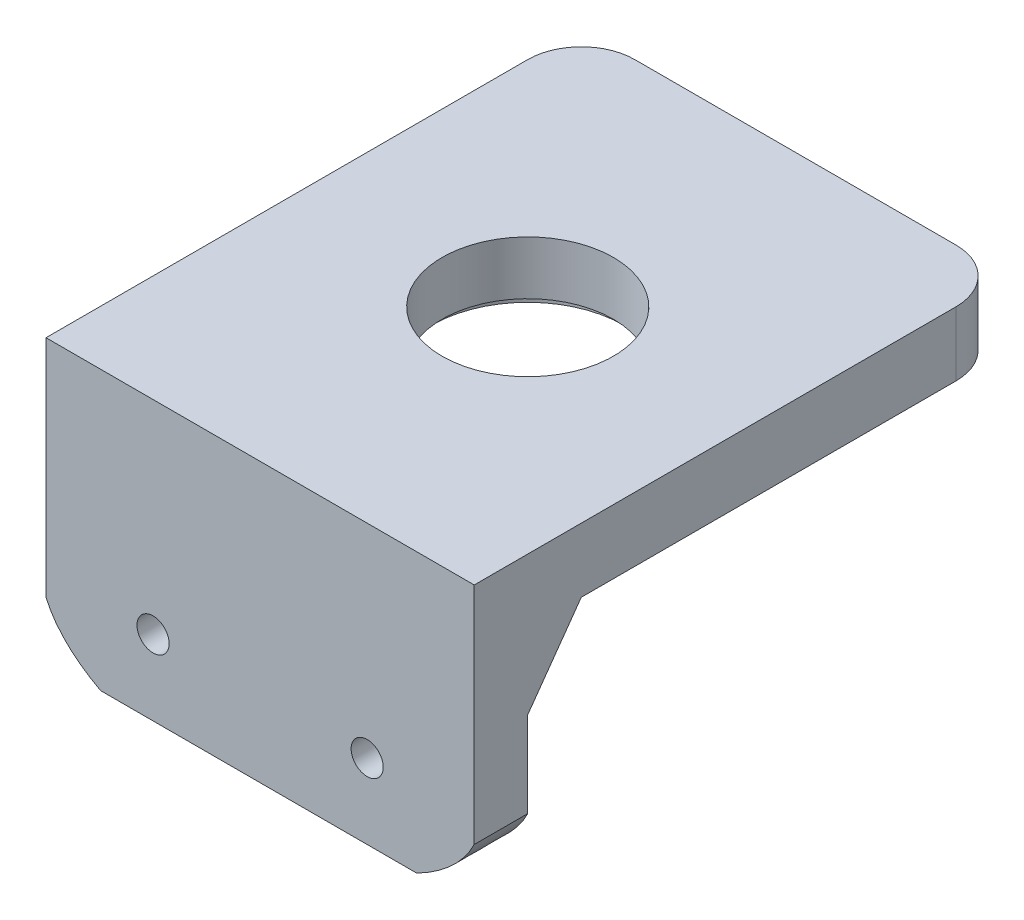
from build123d import *

# Parameters (mm, degrees)
SKETCH1_W           = 40
SKETCH1_H           = 50
BOSS_EXTRUDE1_DEPTH = 6
SKETCH3_R           = 8
CUT_EXTRUDE1_DEPTH  = 9
SKETCH4_W           = 40
SKETCH4_H           = 5
BOSS_EXTRUDE2_DEPTH = 20
BOSS_EXTRUDE3_DEPTH = 40
SKETCH6_R           = 1.5
CUT_EXTRUDE2_DEPTH  = 54.150729064
CUT_EXTRUDE3_DEPTH  = 42.243181255
CUT_EXTRUDE4_DEPTH  = 54.150729064
SKETCH9_R           = 9
CUT_EXTRUDE5_DEPTH  = 1


with BuildPart() as part:
    # Sketch1 → Boss-Extrude1 (new body)
    with BuildSketch(Plane(origin=(0, 0, 0), x_dir=(1, 0, 0), z_dir=(0, 1, 0))):
        Rectangle(SKETCH1_W, SKETCH1_H)
    extrude(amount=BOSS_EXTRUDE1_DEPTH)

    # Sketch3 → Cut-Extrude1 (cut)
    with BuildSketch(Plane(origin=(0, 6, 0), x_dir=(1, 0, 0), z_dir=(0, 1, 0))):
        Circle(SKETCH3_R)
    extrude(amount=-CUT_EXTRUDE1_DEPTH, mode=Mode.SUBTRACT)

    # Sketch4 → Boss-Extrude2 (add)
    with BuildSketch(Plane.XZ):
        with Locations((0, 22.5)):
            Rectangle(SKETCH4_W, SKETCH4_H)
    extrude(amount=BOSS_EXTRUDE2_DEPTH)

    # Sketch5 → Boss-Extrude3 (add)
    with BuildSketch(Plane(origin=(20, 0, 0), x_dir=(0, 0, -1), z_dir=(1, 0, 0))):
        Polygon((-15, 0), (-20, 0), (-20, -7), align=None)
    extrude(amount=-BOSS_EXTRUDE3_DEPTH)

    # Sketch6 → Cut-Extrude2 (cut, through all)
    with BuildSketch(Plane(origin=(0, 0, 20), x_dir=(-1, 0, 0), z_dir=(0, 0, -1))):
        with Locations((-10, -13)):
            Circle(SKETCH6_R)
        with Locations((10, -13)):
            Circle(SKETCH6_R)
    extrude(amount=-CUT_EXTRUDE2_DEPTH, mode=Mode.SUBTRACT)

    # Sketch7 → Cut-Extrude3 (cut, through all)
    with BuildSketch(Plane(origin=(0, 6, 0), x_dir=(1, 0, 0), z_dir=(0, 1, 0))):
        with BuildLine():
            Line((-20, 20), (-20, 25))
            Line((-20, 25), (-15, 25))
            ThreePointArc((-15, 25), (-18.535533906, 23.535533906), (-20, 20))
        make_face()
        with BuildLine():
            Line((15, 25), (20, 25))
            Line((20, 25), (20, 20))
            ThreePointArc((20, 20), (18.535533906, 23.535533906), (15, 25))
        make_face()
    extrude(amount=-CUT_EXTRUDE3_DEPTH, mode=Mode.SUBTRACT)

    # Sketch8 → Cut-Extrude4 (cut, through all)
    with BuildSketch(Plane(origin=(0, 0, 20), x_dir=(-1, 0, 0), z_dir=(0, 0, -1))):
        with BuildLine():
            Line((-20, -20), (-14.628627564, -20))
            add(Edge.make_bspline(
                [(-14.628627564, -20), (-17.085724607, -18.725733446), (-18.991534004, -17.059066779), (-20, -15)],
                knots=[0.809428176, 0.809428176, 0.809428176, 0.809428176, 1, 1, 1, 1], degree=3))
            Line((-20, -15), (-20, -20))
        make_face()
        with BuildLine():
            Line((20, -20), (20, -15))
            add(Edge.make_bspline(
                [(20, -15), (19.102747752, -17.059066779), (17.286957895, -18.725733446), (14.898686187, -20)],
                knots=[0, 0, 0, 0, 0.190571824, 0.190571824, 0.190571824, 0.190571824], degree=3))
            Line((14.898686187, -20), (20, -20))
        make_face()
    extrude(amount=-CUT_EXTRUDE4_DEPTH, mode=Mode.SUBTRACT)

    # Sketch9 → Cut-Extrude5 (cut)
    with BuildSketch(Plane.XZ):
        Circle(SKETCH9_R)
    extrude(amount=-CUT_EXTRUDE5_DEPTH, mode=Mode.SUBTRACT)


solid = part.part
